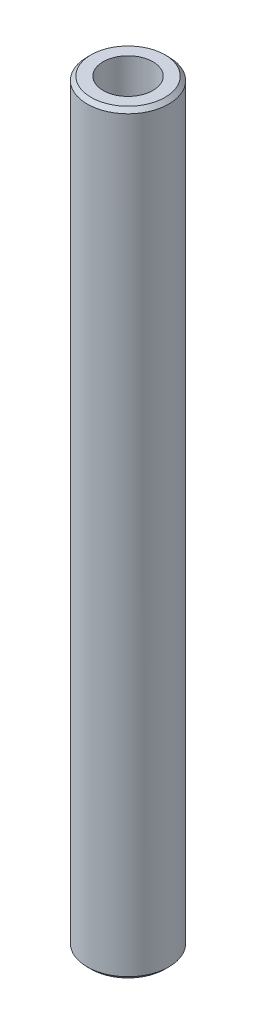
from build123d import *

# Parameters (mm, degrees)
SKETCH1_R           = 22.5
BOSS_EXTRUDE1_DEPTH = 416.63816459
SKETCH2_R           = 13.747466953
CUT_EXTRUDE1_DEPTH  = 418.851481023
CHAMFER1_SIZE       = 2.122116246


with BuildPart() as part:
    # Sketch1 → Boss-Extrude1 (new body)
    with BuildSketch(Plane(origin=(0, 0, 0), x_dir=(1, 0, 0), z_dir=(0, 1, 0))):
        Circle(SKETCH1_R)
    extrude(amount=BOSS_EXTRUDE1_DEPTH)

    # Sketch2 → Cut-Extrude1 (cut, through all)
    with BuildSketch(Plane(origin=(0, 0, 0), x_dir=(1, 0, 0), z_dir=(0, 1, 0))):
        Circle(SKETCH2_R)
    extrude(amount=CUT_EXTRUDE1_DEPTH, mode=Mode.SUBTRACT)

    # Chamfer1
    chamfer1_edges = [part.edges().sort_by_distance(p)[0] for p in [
        (-22.5, 416.63816459, 0),
        (-22.5, 0, 0),
    ]]
    chamfer(chamfer1_edges, length=CHAMFER1_SIZE)


solid = part.part
